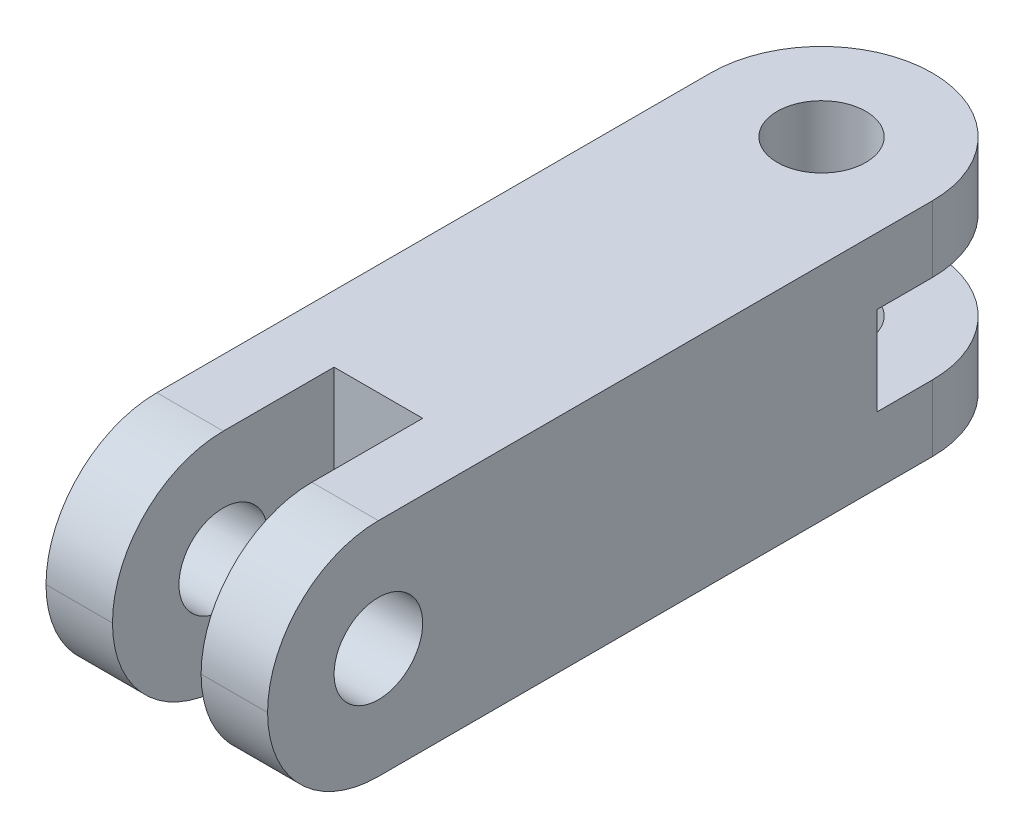
from build123d import *

# Parameters (mm, degrees)
BOSS_EXTRUDE1_DEPTH      = 25
BOSS_EXTRUDE1_DEPTH_BACK = 25
SKETCH1_W                = 175
SKETCH1_H                = 50
SKETCH2_W                = 20
SKETCH2_H                = 50
CUT_EXTRUDE1_DEPTH       = 104.832798286
FILLET2_R                = 25
SKETCH3_W                = 56.175036023
SKETCH3_H                = 20
CUT_EXTRUDE2_DEPTH       = 104.832798286
FILLET6_R                = 25
HOLE1_D                  = 20
HOLE2_D                  = 20


with BuildPart() as part:
    # Sketch1 → Boss-Extrude1 (new, two sides: drawn at the far end of the back side and taken through both)
    with BuildSketch(Plane(origin=(0, 0, 0), x_dir=(0, 0, -1), z_dir=(1, 0, 0)).offset(-BOSS_EXTRUDE1_DEPTH_BACK)):
        Rectangle(SKETCH1_W, SKETCH1_H)
    extrude(amount=BOSS_EXTRUDE1_DEPTH + BOSS_EXTRUDE1_DEPTH_BACK)

    # Sketch2 → Cut-Extrude1 (cut, through all)
    with BuildSketch(Plane(origin=(0, 25, 0), x_dir=(1, 0, 0), z_dir=(0, 1, 0))):
        with Locations((0, -62.5)):
            Rectangle(SKETCH2_W, SKETCH2_H)
    extrude(amount=-CUT_EXTRUDE1_DEPTH, mode=Mode.SUBTRACT)

    # Fillet2
    fillet2_edges = [part.edges().sort_by_distance(p)[0] for p in [
        (-17.5, 25, 87.5),
        (17.5, 25, 87.5),
        (-17.5, -25, 87.5),
        (17.5, -25, 87.5),
    ]]
    fillet(fillet2_edges, radius=FILLET2_R - 0.0001)  # a hair under: the kernel refuses the full size

    # Sketch3 → Cut-Extrude2 (cut, through all)
    with BuildSketch(Plane(origin=(25, 0, 0), x_dir=(0, 0, -1), z_dir=(1, 0, 0))):
        with Locations((78.087518012, 0)):
            Rectangle(SKETCH3_W, SKETCH3_H)
    extrude(amount=-CUT_EXTRUDE2_DEPTH, mode=Mode.SUBTRACT)

    # Fillet6
    fillet6_edges = [part.edges().sort_by_distance(p)[0] for p in [
        (25, 17.5, -87.5),
        (25, -17.5, -87.5),
        (-25, -17.5, -87.5),
        (-25, 17.5, -87.5),
    ]]
    fillet(fillet6_edges, radius=FILLET6_R - 0.0001)  # a hair under: the kernel refuses the full size

    # Hole1 (through all)
    with Locations(Plane(origin=(0, 25, 0), x_dir=(1, 0, 0), z_dir=(0, 1, 0))):
        with Locations((0, 62.5)):
            Hole(HOLE1_D / 2)

    # Hole2 (through all)
    with Locations(Plane.ZY.offset(25)):
        with Locations((62.5, 0)):
            Hole(HOLE2_D / 2)


solid = part.part
